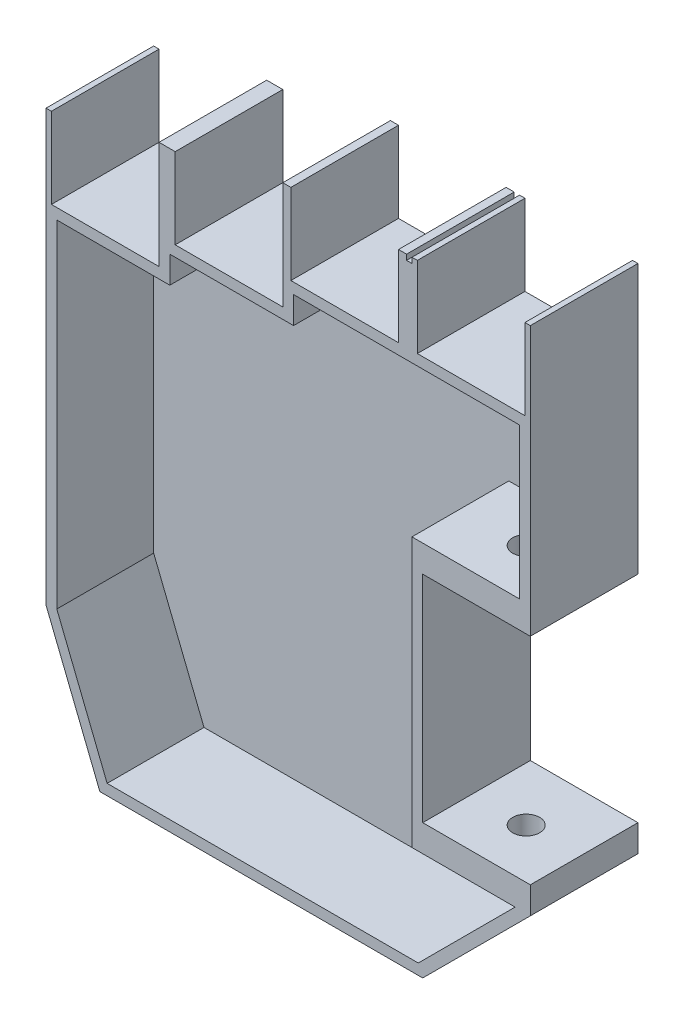
from build123d import *

# Parameters (mm, degrees)
BOSS_EXTRUDE1_DEPTH = 20
SKETCH2_W           = 20
SKETCH2_H           = 40
CUT_EXTRUDE1_DEPTH  = 142.509716981
SKETCH20_W          = 20
SKETCH20_H          = 20
CUT_EXTRUDE11_DEPTH = 15
SKETCH22_W          = 20
SKETCH22_H          = 20
CUT_EXTRUDE13_DEPTH = 15
SKETCH21_W          = 20
SKETCH21_H          = 20
CUT_EXTRUDE12_DEPTH = 15
SHELL1_START        = 2
SHELL1_DEPTH        = 18
CUT_EXTRUDE10_REACH = 110.167
SKETCH19_R          = 2.5


# Read off the part's stored shape, not the designer's step: Shell1
with BuildPart() as part:
    # Sketch1 → Boss-Extrude1 (new body)
    with BuildSketch(Plane.XY):
        Polygon((58, 114), (58, 115), (80, 115), (80, 20), (60, 0), (0, 0), (-10, 25), (-10, 105), (11, 105), (11, 110), (12, 110), (34, 110), (34, 115), (35, 115), (57, 115), (57, 114), align=None)
    extrude(amount=BOSS_EXTRUDE1_DEPTH)

    # Sketch2 → Cut-Extrude1 (cut, through all)
    with BuildSketch(Plane.XY.offset(20)):
        with Locations((70, 45)):
            Rectangle(SKETCH2_W, SKETCH2_H)
    extrude(amount=-CUT_EXTRUDE1_DEPTH, mode=Mode.SUBTRACT)

    # Sketch20 → Cut-Extrude11 (cut)
    with BuildSketch(Plane(origin=(0, 115, 0), x_dir=(1, 0, 0), z_dir=(0, 1, 0))):
        with Locations((69, -10)):
            Rectangle(SKETCH20_W, SKETCH20_H)
        with Locations((45.5, -10)):
            Rectangle(SKETCH20_W, SKETCH20_H)
    extrude(amount=-CUT_EXTRUDE11_DEPTH, mode=Mode.SUBTRACT)

    # Sketch22 → Cut-Extrude13 (cut)
    with BuildSketch(Plane(origin=(0, 105, 0), x_dir=(1, 0, 0), z_dir=(0, 1, 0))):
        with Locations((1, -10)):
            Rectangle(SKETCH22_W, SKETCH22_H)
    extrude(amount=-CUT_EXTRUDE13_DEPTH, mode=Mode.SUBTRACT)

    # Sketch21 → Cut-Extrude12 (cut)
    with BuildSketch(Plane(origin=(0, 110, 0), x_dir=(1, 0, 0), z_dir=(0, 1, 0))):
        with Locations((24, -10)):
            Rectangle(SKETCH21_W, SKETCH21_H)
    extrude(amount=-CUT_EXTRUDE12_DEPTH, mode=Mode.SUBTRACT)

    # Shell1 outline → Shell1 (cut)
    with BuildSketch(Plane.XY.offset(SHELL1_START)):
        Polygon((58, 20), (58, 70), (78, 70), (78, 98), (36, 98), (36, 93), (13, 93), (13, 88), (-8, 88), (-8, 25.385164807), (1.354065923, 2), (59.171572875, 2), (77.171572875, 20), align=None)
    extrude(amount=SHELL1_DEPTH, mode=Mode.SUBTRACT)

    # Cut-Extrude10: up to this face of the body (flat: up to its plane)
    cut_extrude10_end = Plane(part.part.faces().sort_by_distance((67.585786438, 20, 11))[0])
    # Sketch19 → Cut-Extrude10 (cut, up to the picked face)
    with BuildSketch(Plane(origin=(0, 70, 0), x_dir=(1, 0, 0), z_dir=(0, 1, 0)), mode=Mode.PRIVATE) as cut_extrude10_sk1:
        with Locations(Location((70, -10.774964387, 0), (0, 0, 270))):
            Circle(SKETCH19_R)
    cut_extrude10_tool1 = split(extrude(cut_extrude10_sk1.sketch, amount=-CUT_EXTRUDE10_REACH, mode=Mode.PRIVATE), bisect_by=cut_extrude10_end, keep=Keep.BOTH, mode=Mode.PRIVATE)
    add(cut_extrude10_tool1.solids().sort_by(Axis((70, 70, 10.774964), (0, -1, 0)))[0], mode=Mode.SUBTRACT)


solid = part.part
